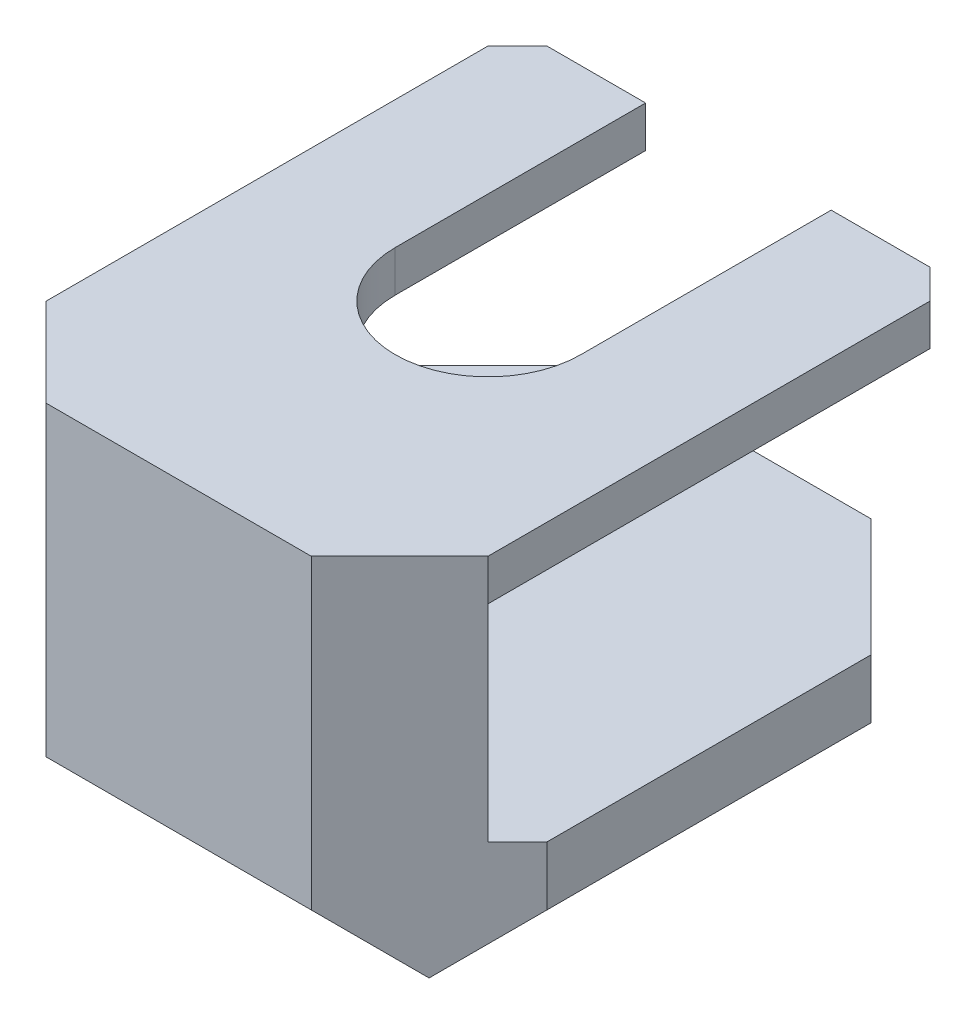
from build123d import *

# Parameters (mm, degrees)
BOSS_EXTRUDE1_DEPTH = 1.4
BOSS_EXTRUDE2_DEPTH = 15
SKETCH6_W           = 17
SKETCH6_H           = 17
BOSS_EXTRUDE3_DEPTH = 6
CUT_EXTRUDE4_START  = -16
SKETCH8_W           = 17
SKETCH8_H           = 7
CUT_EXTRUDE4_DEPTH  = 16
SKETCH9_W           = 17
SKETCH9_H           = 22.4
BOSS_EXTRUDE4_DEPTH = 2
SKETCH7_4_R         = 2.45
CUT_EXTRUDE3_DEPTH  = 4.5
CHAMFER1_SIZE       = 4
CHAMFER3_SIZE       = 4
CUT_EXTRUDE5_REACH  = 28.158
CHAMFER4_SIZE       = 1
SPLIT1_START        = 2.45
SPLIT1_DEPTH        = 4.05
SPLIT1_START_2      = -4.5
SPLIT1_2_DEPTH      = 2.0499999
SPLIT1_START_3      = -21
SPLIT1_3_DEPTH      = 6
SPLIT1_START_4      = -16.5
SPLIT1_4_OUTLINE_R  = 2.45
SPLIT1_4_DEPTH      = 1.5
SPLIT1_START_5      = -20.859650045
SPLIT1_5_OUTLINE_W  = 20
SPLIT1_5_OUTLINE_H  = 18
SPLIT1_5_DEPTH      = 2.828427125
SPLIT1_START_6      = -22.273863607
SPLIT1_6_OUTLINE_W  = 20
SPLIT1_6_OUTLINE_H  = 18
SPLIT1_6_DEPTH      = 2.828427124
SPLIT1_START_7      = -9
SPLIT1_7_DEPTH      = 20
SPLIT1_8_DEPTH      = 14


with BuildPart() as part:
    # Sketch3 → Boss-Extrude1 (new body)
    with BuildSketch(Plane(origin=(0, 0, 0), x_dir=(1, 0, 0), z_dir=(0, 1, 0))):
        with BuildLine():
            Line((-3.15, 0), (-3.15, 8.5))
            Line((-3.15, 8.5), (-8.5, 8.5))
            Line((-8.5, 8.5), (-8.5, -8.5))
            Line((-8.5, -8.5), (8.5, -8.5))
            Line((8.5, -8.5), (8.5, 8.5))
            Line((8.5, 8.5), (3.15, 8.5))
            Line((3.15, 8.5), (3.15, 0))
            ThreePointArc((3.15, 0), (0, -3.15), (-3.15, 0))
        make_face()
    extrude(amount=BOSS_EXTRUDE1_DEPTH)

    # Sketch4 → Boss-Extrude2 (add)
    with BuildSketch(Plane.XZ):
        with BuildLine():
            Line((7.5, 0), (7.5, -8.5))
            Line((7.5, -8.5), (8.5, -8.5))
            Line((8.5, -8.5), (8.5, 8.5))
            Line((8.5, 8.5), (-8.5, 8.5))
            Line((-8.5, 8.5), (-8.5, -8.5))
            Line((-8.5, -8.5), (-7.5, -8.5))
            Line((-7.5, -8.5), (-7.5, 0))
            ThreePointArc((-7.5, 0), (0, 7.5), (7.5, 0))
        make_face()
    extrude(amount=BOSS_EXTRUDE2_DEPTH)

    # Sketch6 → Boss-Extrude3 (add)
    with BuildSketch(Plane.XZ.offset(15)):
        Rectangle(SKETCH6_W, SKETCH6_H)
    extrude(amount=BOSS_EXTRUDE3_DEPTH)

    # Sketch8 → Cut-Extrude4 (cut)
    with BuildSketch(Plane(origin=(0, 0, -8.5), x_dir=(-1, 0, 0), z_dir=(0, 0, -1)).offset(CUT_EXTRUDE4_START)):
        with Locations((0, -3.5)):
            Rectangle(SKETCH8_W, SKETCH8_H)
    extrude(amount=CUT_EXTRUDE4_DEPTH, mode=Mode.SUBTRACT)

    # Sketch9 → Boss-Extrude4 (add)
    with BuildSketch(Plane.XY.offset(8.5)):
        with Locations((0, -9.8)):
            Rectangle(SKETCH9_W, SKETCH9_H)
    extrude(amount=BOSS_EXTRUDE4_DEPTH)

    # Sketch7<4> → Cut-Extrude3 (cut)
    with BuildSketch(Plane.XZ.offset(21)):
        with Locations(Location((0, 0, 0), (0, 0, 270))):
            Circle(SKETCH7_4_R)
    extrude(amount=-CUT_EXTRUDE3_DEPTH, mode=Mode.SUBTRACT)

    # Chamfer1
    chamfer1_edges = [part.edges().sort_by_distance(p)[0] for p in [
        (0, -21, 10.5),
        (-8.5, -21, 1),
        (0, -21, -8.5),
        (8.5, -21, 1),
    ]]
    chamfer(chamfer1_edges, length=CHAMFER1_SIZE)

    # Chamfer3
    # the kernel refuses this chamfer: 4 mm, written as the material it takes off along each edge
    with BuildSketch(Plane(origin=(8.5, -27.286731952, 10.5), x_dir=(-1, 0, 0), z_dir=(0, 1, 0))) as chamfer3_piece_1:
        Polygon((CHAMFER3_SIZE, 0), (0, -CHAMFER3_SIZE), (0, 0), align=None)
    extrude(amount=38.973463904, mode=Mode.SUBTRACT)
    with BuildSketch(Plane(origin=(8.5, -7, -8.5), x_dir=(-1, 0, 0), z_dir=(0, -1, 0))) as chamfer3_piece_2:
        Polygon((CHAMFER3_SIZE, 0), (0, -CHAMFER3_SIZE), (0, 0), align=None)
    extrude(amount=20.286731952, mode=Mode.SUBTRACT)
    with BuildSketch(Plane(origin=(-8.5, -27.286731952, -8.5), x_dir=(0, 0, 1), z_dir=(0, 1, 0))) as chamfer3_piece_3_section:
        Polygon((CHAMFER3_SIZE, 0), (0, CHAMFER3_SIZE), (0, 0), align=None)
    chamfer3_piece_3 = extrude(amount=30.573463904, mode=Mode.PRIVATE)
    chamfer3_piece_3 = split(chamfer3_piece_3, bisect_by=Plane(origin=(-8.5, 0, -8.5), z_dir=(0, -1, 0)), keep=Keep.TOP, mode=Mode.PRIVATE)
    add(chamfer3_piece_3, mode=Mode.SUBTRACT)
    with BuildSketch(Plane(origin=(-8.5, 11.686731952, 10.5), x_dir=(0, 0, -1), z_dir=(0, -1, 0))) as chamfer3_piece_4:
        Polygon((CHAMFER3_SIZE, 0), (0, CHAMFER3_SIZE), (0, 0), align=None)
    extrude(amount=38.973463904, mode=Mode.SUBTRACT)

    # Sketch10 → Cut-Extrude5 (cut, up to next)
    with BuildSketch(Plane(origin=(0, 1.4, 0), x_dir=(1, 0, 0), z_dir=(0, 1, 0)), mode=Mode.PRIVATE) as cut_extrude5_sk1:
        Polygon((7.5, -7.5), (7.5, 8.5), (8.5, 8.5), (8.5, -6.5), align=None)
    cut_extrude5_tool1 = extrude(cut_extrude5_sk1.sketch, amount=-CUT_EXTRUDE5_REACH, mode=Mode.PRIVATE) & part.part
    # Sketch10 → Cut-Extrude5 (cut, up to next)
    with BuildSketch(Plane(origin=(0, 1.4, 0), x_dir=(1, 0, 0), z_dir=(0, 1, 0)), mode=Mode.PRIVATE) as cut_extrude5_sk2:
        Polygon((-7.5, -7.5), (-7.5, 8.5), (-8.5, 8.5), (-8.5, -6.5), align=None)
    cut_extrude5_tool2 = extrude(cut_extrude5_sk2.sketch, amount=-CUT_EXTRUDE5_REACH, mode=Mode.PRIVATE) & part.part
    add(cut_extrude5_tool1.solids().sort_by_distance((7.994624, 1.4, -0.747312))[0], mode=Mode.SUBTRACT)
    add(cut_extrude5_tool2.solids().sort_by_distance((-7.994624, 1.4, -0.747312))[0], mode=Mode.SUBTRACT)

    # Chamfer4
    chamfer4_edges = [part.edges().sort_by_distance(p)[0] for p in [
        (7.5, 0.7, -8.5),
        (-7.5, 0.7, -8.5),
    ]]
    chamfer(chamfer4_edges, length=CHAMFER4_SIZE)

    # Split1 8 outline → Split1 8 (cut)
    with BuildSketch(Plane(origin=(0, 0, 0), x_dir=(1, 0, 0), z_dir=(0, 1, 0)).offset(SPLIT1_START_3)):
        Polygon((-8.5, 4.5), (-8.5, -6.5), (-4.5, -10.5), (4.5, -10.5), (8.5, -6.5), (8.5, 4.5), (4.5, 8.5), (-4.5, 8.5), align=None)
    extrude(amount=SPLIT1_8_DEPTH, mode=Mode.SUBTRACT)


with BuildPart() as body_2:
    # Split1: read off the stored shape, not the designer's step
    # Split1 outline → Split1 (new body)
    with BuildSketch(Plane.XY.offset(SPLIT1_START)):
        Polygon((8.5, -17), (8.5, -15), (-8.5, -15), (-8.5, -17), (-4.5, -21), (4.5, -21), align=None)
    extrude(amount=SPLIT1_DEPTH)

    # Split1 2 outline → Split1 2 (add)
    with BuildSketch(Plane.XY.offset(SPLIT1_START_2)):
        Polygon((8.5, -17), (8.5, -15), (-8.5, -15), (-8.5, -17), (-4.5, -21), (4.5, -21), align=None)
    extrude(amount=SPLIT1_2_DEPTH)

    # Split1 3 outline → Split1 3 (add)
    with BuildSketch(Plane(origin=(0, 0, 0), x_dir=(1, 0, 0), z_dir=(0, 1, 0)).offset(SPLIT1_START_3)):
        with BuildLine():
            ThreePointArc((0, 2.45), (2.45, 0), (0, -2.45))
            Line((0, -2.45), (8.5, -2.45))
            Line((8.5, -2.45), (8.5, 2.4500001))
            Line((8.5, 2.4500001), (0, 2.45))
        make_face()
        with BuildLine():
            ThreePointArc((0, -2.45), (-2.45, 0), (0, 2.45))
            Line((0, 2.45), (-8.5, 2.4500001))
            Line((-8.5, 2.4500001), (-8.5, -2.45))
            Line((-8.5, -2.45), (0, -2.45))
        make_face()
        Polygon((-4.5, 8.5), (-8.5, 4.5), (8.5, 4.5), (4.5, 8.5), align=None)
        Polygon((8.5, -6.5), (-8.5, -6.5), (-4.5, -10.5), (4.5, -10.5), align=None)
    extrude(amount=SPLIT1_3_DEPTH)

    # Split1 4 outline → Split1 4 (add)
    with BuildSketch(Plane(origin=(0, 0, 0), x_dir=(1, 0, 0), z_dir=(0, 1, 0)).offset(SPLIT1_START_4)):
        Circle(SPLIT1_4_OUTLINE_R)
    extrude(amount=SPLIT1_4_DEPTH)

    # Split1 5 outline → Split1 5 (cut)
    with BuildSketch(Plane(origin=(0, 0, 0), x_dir=(1, 0, 0), z_dir=(0, 0.707106781186546, 0.707106781186549)).offset(SPLIT1_START_5)):
        with Locations((0, -14)):
            Rectangle(SPLIT1_5_OUTLINE_W, SPLIT1_5_OUTLINE_H)
    extrude(amount=SPLIT1_5_DEPTH, mode=Mode.SUBTRACT)

    # Split1 6 outline → Split1 6 (cut)
    with BuildSketch(Plane(origin=(0, 0, 0), x_dir=(1, 0, 0), z_dir=(0, 0.707106781186546, -0.707106781186549)).offset(SPLIT1_START_6)):
        with Locations((0, 12)):
            Rectangle(SPLIT1_6_OUTLINE_W, SPLIT1_6_OUTLINE_H)
    extrude(amount=SPLIT1_6_DEPTH, mode=Mode.SUBTRACT)

    # Split1 7 outline → Split1 7 (cut)
    with BuildSketch(Plane.XY.offset(SPLIT1_START_7)):
        Polygon((-8.5, -21), (-4.5, -21), (-8.5, -17), align=None)
        Polygon((8.5, -21), (8.5, -17), (4.5, -21), align=None)
    extrude(amount=SPLIT1_7_DEPTH, mode=Mode.SUBTRACT)


with BuildPart() as body_2_1:
    # Body-Move/Copy2: read off the stored shape, not the designer's step
    # Body-Move/Copy2: moved
    add(body_2.part.moved(Location((0, 8, 0))))


with BuildPart() as part_1:
    add(part.part)

    # Combine2: union body 2
    add(body_2_1.part)


solid = part_1.part
